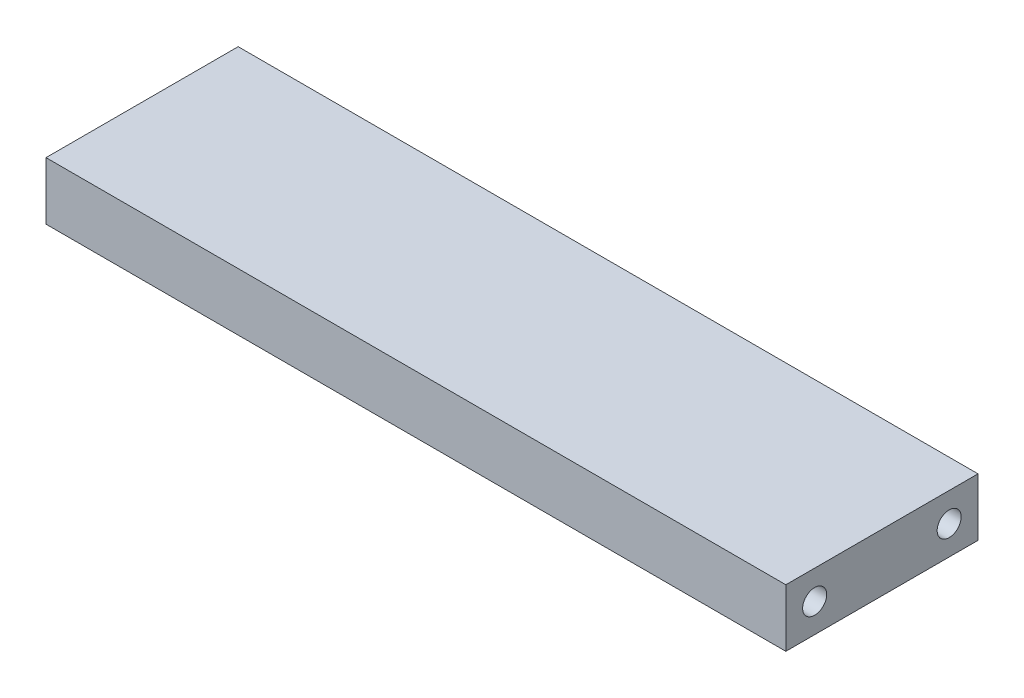
from build123d import *

# Parameters (mm, degrees)
SKETCH1_W                   = 77
SKETCH1_H                   = 20
BOSS_EXTRUDE1_DEPTH         = 6
TAP_DRILL_FOR_M3_TAP1_D     = 2.5
TAP_DRILL_FOR_M3_TAP1_DEPTH = 10
TAP_DRILL_FOR_M3_TAP1_TIP   = 0.751075774
TAP_DRILL_FOR_M3_TAP2_D     = 2.5
TAP_DRILL_FOR_M3_TAP2_DEPTH = 10
TAP_DRILL_FOR_M3_TAP2_TIP   = 0.751075774


with BuildPart() as part:
    # Sketch1 → Boss-Extrude1 (new body)
    with BuildSketch(Plane(origin=(0, 0, 0), x_dir=(1, 0, 0), z_dir=(0, 1, 0))):
        with Locations((38.5, 10)):
            Rectangle(SKETCH1_W, SKETCH1_H)
    extrude(amount=BOSS_EXTRUDE1_DEPTH)

    # Tap Drill for M3 Tap1
    with Locations(Plane.ZY):
        with Locations((-17, 3), (-3, 3)):
            Hole(TAP_DRILL_FOR_M3_TAP1_D / 2, depth=TAP_DRILL_FOR_M3_TAP1_DEPTH)
            with Locations((0, 0, -(TAP_DRILL_FOR_M3_TAP1_DEPTH + TAP_DRILL_FOR_M3_TAP1_TIP / 2))):  # 118° drill point
                Cone(0, TAP_DRILL_FOR_M3_TAP1_D / 2, TAP_DRILL_FOR_M3_TAP1_TIP, mode=Mode.SUBTRACT)

    # Tap Drill for M3 Tap2
    with Locations(Plane(origin=(77, 0, 0), x_dir=(0, 0, -1), z_dir=(1, 0, 0))):
        with Locations((3, 3), (17, 3)):
            Hole(TAP_DRILL_FOR_M3_TAP2_D / 2, depth=TAP_DRILL_FOR_M3_TAP2_DEPTH)
            with Locations((0, 0, -(TAP_DRILL_FOR_M3_TAP2_DEPTH + TAP_DRILL_FOR_M3_TAP2_TIP / 2))):  # 118° drill point
                Cone(0, TAP_DRILL_FOR_M3_TAP2_D / 2, TAP_DRILL_FOR_M3_TAP2_TIP, mode=Mode.SUBTRACT)


solid = part.part
